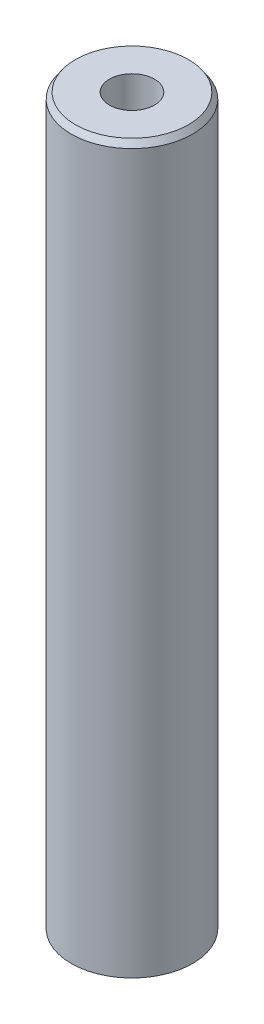
from build123d import *
from OCP.BRepFilletAPI import BRepFilletAPI_MakeChamfer

# Parameters (mm, degrees)
SKETCH1_R           = 50
BOSS_EXTRUDE1_DEPTH = 600
SKETCH2_R           = 18.552716965
CUT_EXTRUDE1_DEPTH  = 605.15229868
CHAMFER1_SIZE       = 4.961233849
CHAMFER1_SIZE2      = 3.469229745


with BuildPart() as part:
    # Sketch1 → Boss-Extrude1 (new body)
    with BuildSketch(Plane(origin=(0, 0, 0), x_dir=(1, 0, 0), z_dir=(0, 1, 0))):
        Circle(SKETCH1_R)
    extrude(amount=BOSS_EXTRUDE1_DEPTH)

    # Sketch2 → Cut-Extrude1 (cut, through all)
    with BuildSketch(Plane(origin=(0, 0, 0), x_dir=(1, 0, 0), z_dir=(0, 1, 0))):
        Circle(SKETCH2_R)
    extrude(amount=CUT_EXTRUDE1_DEPTH, mode=Mode.SUBTRACT)

    # Chamfer1: one chamfer whose edges measure the first distance from different faces: ONE call of the kernel's chamfer builder (chamfer() names one face for all edges)
    chamfer1_edges_1 = [part.edges().sort_by_distance(p)[0] for p in [
        (-50, 600, 0),
    ]]
    chamfer1_side_1 = [part.faces().sort_by_distance(p)[0] for p in [
        (-50, 300, 0),
    ]]
    chamfer1_edges_2 = [part.edges().sort_by_distance(p)[0] for p in [
        (-50, 0, 0),
    ]]
    chamfer1_side_2 = [part.faces().sort_by_distance(p)[0] for p in [
        (-48.585786438, 0, 0),
    ]]
    chamfer1 = BRepFilletAPI_MakeChamfer(part.part.solid().wrapped)
    for e in chamfer1_edges_1:
        chamfer1.Add(CHAMFER1_SIZE, CHAMFER1_SIZE2, e.wrapped, chamfer1_side_1[0].wrapped)  # the first distance lies on this face
    for e in chamfer1_edges_2:
        chamfer1.Add(CHAMFER1_SIZE, CHAMFER1_SIZE2, e.wrapped, chamfer1_side_2[0].wrapped)  # the first distance lies on this face
    add(Compound.cast(chamfer1.Shape()), mode=Mode.REPLACE)


solid = part.part
